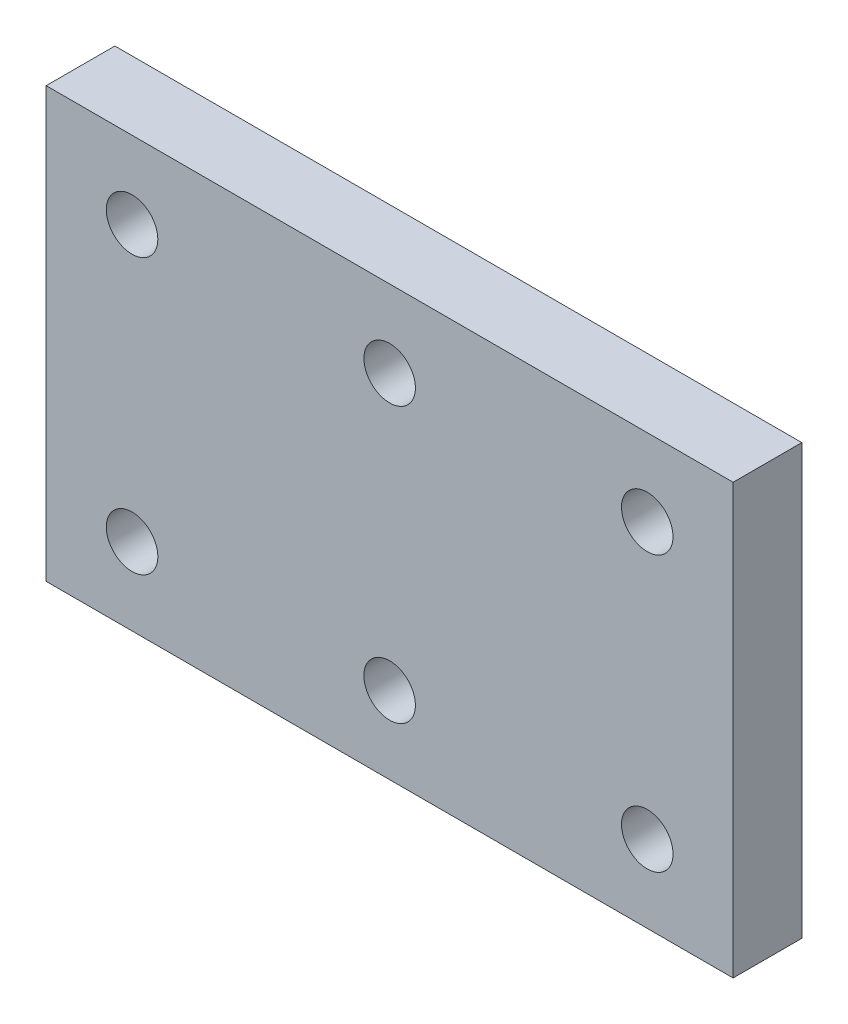
from build123d import *

# Parameters (mm, degrees)
SKETCH_2_W          = 40
SKETCH_2_H          = 25
EXTRUDE_1_DEPTH     = 4
SKETCH_3_R          = 1.5
CUT_EXTRUDE_1_DEPTH = 4


with BuildPart() as part:
    # 草图2 → 凸台-拉伸1 (new body)
    with BuildSketch(Plane.XY):
        Rectangle(SKETCH_2_W, SKETCH_2_H)
    extrude(amount=EXTRUDE_1_DEPTH)

    # 草图3 → 切除-拉伸1 (cut)
    with BuildSketch(Plane.XY.offset(4)):
        with Locations((-15, 8)):
            Circle(SKETCH_3_R)
        with Locations((0, 8)):
            Circle(SKETCH_3_R)
        with Locations((15, 8)):
            Circle(SKETCH_3_R)
        with Locations((15, -8)):
            Circle(SKETCH_3_R)
        with Locations((0, -8)):
            Circle(SKETCH_3_R)
        with Locations((-15, -8)):
            Circle(SKETCH_3_R)
    extrude(amount=-CUT_EXTRUDE_1_DEPTH, mode=Mode.SUBTRACT)


solid = part.part
